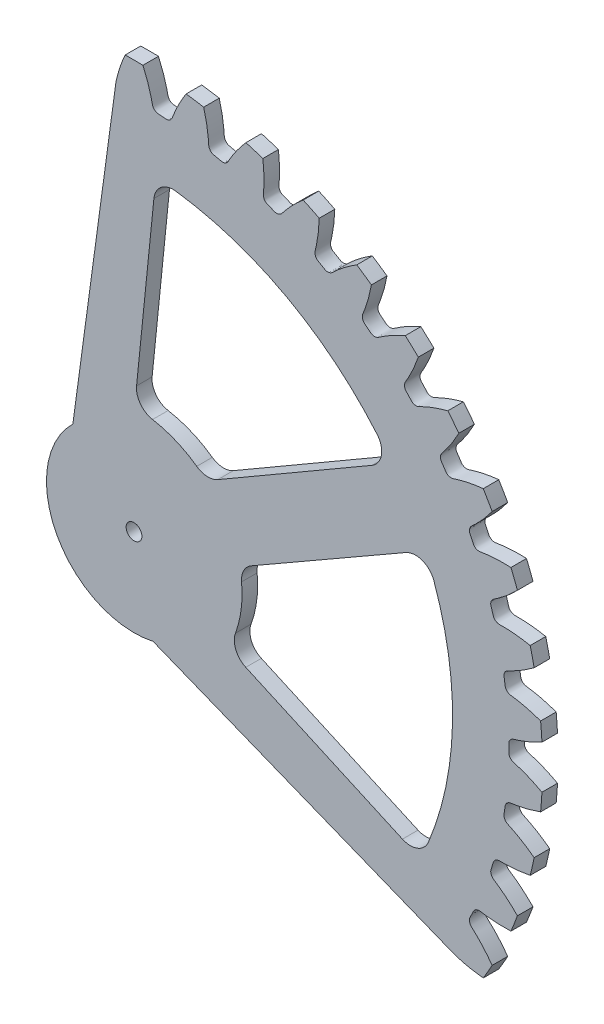
from build123d import *

# Parameters (mm, degrees)
SKETCHREVOLVEGEARTRAX1PINION_W       = 8
SKETCHREVOLVEGEARTRAX1PINION_H       = 209.980195238
TOOTHEXTRUDECUTGEARTRAX1PINION_DEPTH = 4
PATTERNGEARTRAX1PINION_COUNT         = 42
BOREREVOLVESKETCH_W                  = 8
BOREREVOLVESKETCH_H                  = 4.05
SKETCH1_OUTSIDE_W                    = 540.08
SKETCH1_OUTSIDE_H                    = 540.67
CUT_EXTRUDE1_DEPTH                   = 297.855935507
SKETCH2_R                            = 4.05
BOSS_EXTRUDE1_DEPTH                  = 8
CUT_EXTRUDE2_DEPTH                   = 297.855935507
FILLET1_R                            = 10


with BuildPart() as part:
    # SketchRevolveGeartrax1Pinion → Geartrax1Pinion (revolve)
    with BuildSketch(Plane(origin=(0, 0, 0), x_dir=(0, 0, -1), z_dir=(1, 0, 0))):
        with Locations((0, 104.990097619)):
            Rectangle(SKETCHREVOLVEGEARTRAX1PINION_W, SKETCHREVOLVEGEARTRAX1PINION_H)
    revolve(axis=Axis((0, 0, 0), (0, 0, -1)))

    # SketchToothGeartrax1Pinion → ToothExtrudeCutGeartrax1Pinion (cut, symmetric)
    with BuildSketch(Plane.XY):
        with BuildLine():
            ThreePointArc((210.059933834, 11.33399194), (210.36548, 0), (210.059933834, -11.33399194))
            add(Edge.make_bspline(
                [(210.059933834, -11.33399194), (209.421712001, -10.98805077), (208.471052933, -10.487497457), (207.208647382, -9.852911722), (206.295457125, -9.407970577), (205.403271631, -8.986874438), (204.532537889, -8.589031905), (203.683691431, -8.213844047), (202.85715618, -7.860704873), (202.053344474, -7.529001119), (201.272656478, -7.218113742), (200.515481788, -6.927413569), (199.782193278, -6.656277572), (199.073168377, -6.404032323), (198.388713668, -6.170154131), (197.729329514, -5.953566406), (197.094781685, -5.755104522), (196.206981038, -5.48295037), (195.441662388, -5.300071786), (194.837326585, -5.055686253), (194.618568492, -4.955054269), (194.391819671, -4.835690495), (194.153968078, -4.690839639), (193.902208025, -4.510782839), (193.635513374, -4.281846336), (193.357655143, -3.986067597), (193.081848485, -3.603213915), (192.837801446, -3.118326005), (192.668707899, -2.550089425), (192.596070969, -1.495109784), (192.677613048, 0), (192.596070969, 1.495109784), (192.668707899, 2.550089425), (192.837801446, 3.118326005), (193.081848485, 3.603213915), (193.357655143, 3.986067597), (193.635513374, 4.281846336), (193.902208025, 4.510782839), (194.153968078, 4.690839639), (194.391819671, 4.835690495), (194.618568492, 4.955054269), (194.837326585, 5.055686253), (195.441662388, 5.300071786), (196.206981038, 5.48295037), (197.094781685, 5.755104522), (197.729329514, 5.953566406), (198.388713668, 6.170154131), (199.073168377, 6.404032323), (199.782193278, 6.656277572), (200.515481788, 6.927413569), (201.272656478, 7.218113742), (202.053344474, 7.529001119), (202.85715618, 7.860704873), (203.683691431, 8.213844047), (204.532537889, 8.589031905), (205.403271631, 8.986874438), (206.295457125, 9.407970577), (207.208647382, 9.852911722), (208.471052933, 10.487497457), (209.421712001, 10.98805077), (210.059933834, 11.33399194)],
                knots=[0, 0, 0, 0, 0.048419669, 0.07165402, 0.094238049, 0.116171756, 0.137455141, 0.158088204, 0.178070945, 0.197403364, 0.216085461, 0.234117236, 0.251498689, 0.268229819, 0.284310628, 0.299741114, 0.314521279, 0.328651121, 0.361695917, 0.366792154, 0.372106347, 0.377751025, 0.383873891, 0.390667124, 0.398373715, 0.407280353, 0.417674397, 0.429732683, 0.443337286, 0.456891669, 0.5, 0.543108331, 0.556662714, 0.570267317, 0.582325603, 0.592719647, 0.601626285, 0.609332876, 0.616126109, 0.622248975, 0.627893653, 0.633207846, 0.638304083, 0.671348879, 0.685478721, 0.700258886, 0.715689372, 0.731770181, 0.748501311, 0.765882764, 0.783914539, 0.802596636, 0.821929055, 0.841911796, 0.862544859, 0.883828244, 0.905761951, 0.92834598, 0.951580331, 1, 1, 1, 1], degree=3))
        make_face()
    toothextrudecutgeartrax1pinion = extrude(amount=TOOTHEXTRUDECUTGEARTRAX1PINION_DEPTH, both=True, mode=Mode.SUBTRACT)

    # PatternGeartrax1Pinion: ToothExtrudeCutGeartrax1Pinion ×42 about axis
    patterngeartrax1pinion_axis = Axis((0, 0, 4.4), (0, 0, -1))
    for i in range(1, PATTERNGEARTRAX1PINION_COUNT):
        add(toothextrudecutgeartrax1pinion.rotate(patterngeartrax1pinion_axis, i * 360 / PATTERNGEARTRAX1PINION_COUNT), mode=Mode.SUBTRACT)

    # BoreRevolveSketch → BoreRevolveCut (revolve, cut)
    with BuildSketch(Plane(origin=(0, 0, 0), x_dir=(0, 0, -1), z_dir=(1, 0, 0))):
        with Locations((0, 2.025)):
            Rectangle(BOREREVOLVESKETCH_W, BOREREVOLVESKETCH_H)
    revolve(axis=Axis((0, 0, 0), (0, 0, -1)), mode=Mode.SUBTRACT)

    # Sketch1 outside → Cut-Extrude1 (cut, through all)
    with BuildSketch(Plane.XY.offset(4)):
        Rectangle(SKETCH1_OUTSIDE_W, SKETCH1_OUTSIDE_H)
        with BuildLine():
            Line((0, 0), (-9.980754911, 209.742859053))
            ThreePointArc((-9.980754911, 209.742859053), (181.848183368, 104.990097619), (176.652266747, -113.515016828))
            Line((176.652266747, -113.515016828), (0, 0))
        make_face(mode=Mode.SUBTRACT)
    extrude(amount=-CUT_EXTRUDE1_DEPTH, mode=Mode.SUBTRACT)

    # Sketch2 → Boss-Extrude1 (add)
    with BuildSketch(Plane.XY.offset(4)):
        with BuildLine():
            Line((-9.30197912, 195.478569805), (-31.432718835, 32.202238845))
            ThreePointArc((-31.432718835, 32.202238845), (-39.575663351, -21.418843814), (9.769255778, -43.926775907))
            Line((9.769255778, -43.926775907), (164.638417787, -105.795035126))
            Line((164.638417787, -105.795035126), (45, 0))
            ThreePointArc((45, 0), (31.819805153, 31.819805153), (0, 45))
            Line((0, 45), (-9.30197912, 195.478569805))
        make_face()
        Circle(SKETCH2_R, mode=Mode.SUBTRACT)
    extrude(amount=-BOSS_EXTRUDE1_DEPTH)

    # Sketch3 → Cut-Extrude2 (cut, through all)
    with BuildSketch(Plane.XY.offset(4)):
        with BuildLine():
            Line((147.092053426, -71.9568486), (48.247746923, -27.51911082))
            ThreePointArc((48.247746923, -27.51911082), (54.881681702, -8.552634507), (54.333549897, 11.533078474))
            Line((54.333549897, 11.533078474), (149.715027231, 66.326999502))
            ThreePointArc((149.715027231, 66.326999502), (163.719932945, -3.105446524), (147.092053426, -71.9568486))
        make_face()
        with BuildLine():
            Line((11.229567849, 163.363879262), (0.291624402, 55.543329921))
            ThreePointArc((0.291624402, 55.543329921), (20.034042099, 51.80524781), (37.154713891, 41.287695252))
            Line((37.154713891, 41.287695252), (132.298380141, 96.493517159))
            ThreePointArc((132.298380141, 96.493517159), (79.170570893, 143.338344298), (11.229567849, 163.363879262))
        make_face()
    extrude(amount=-CUT_EXTRUDE2_DEPTH, mode=Mode.SUBTRACT)

    # Fillet1
    fillet1_edges = [part.edges().sort_by_distance(p)[0] for p in [
        (147.092053426, -71.9568486, 0),
        (48.247746923, -27.51911082, 0),
        (54.333549897, 11.533078474, 0),
        (149.715027231, 66.326999502, 0),
        (11.229567849, 163.363879262, 0),
        (132.298380141, 96.493517159, 0),
        (37.154713891, 41.287695252, 0),
        (0.291624402, 55.543329921, 0),
    ]]
    fillet(fillet1_edges, radius=FILLET1_R)


solid = part.part
